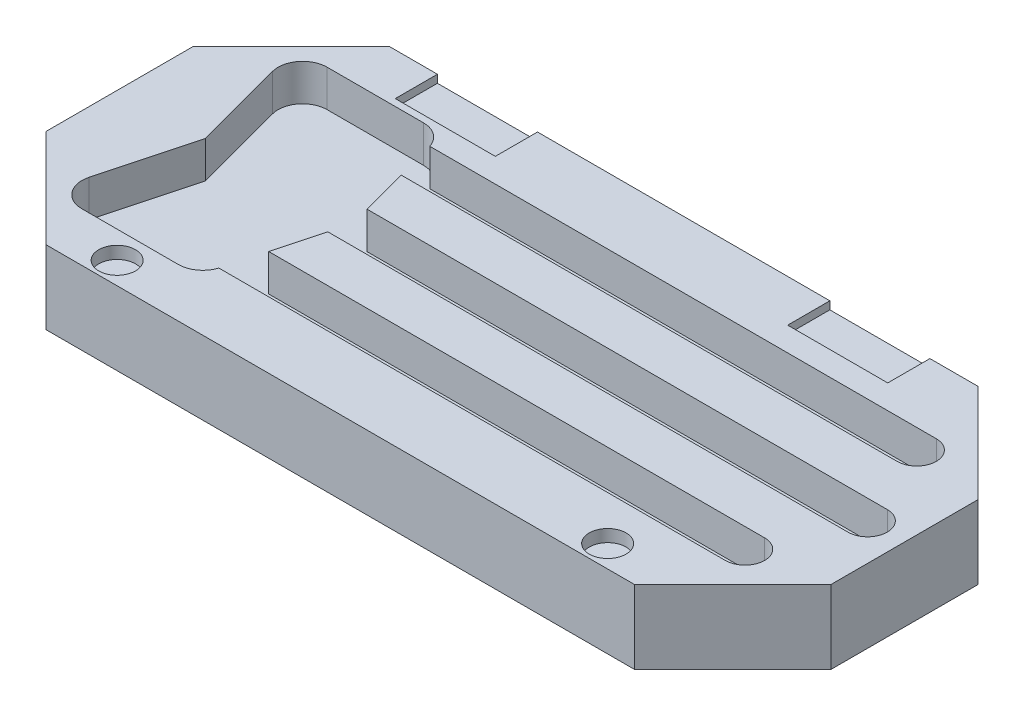
from build123d import *

# Parameters (mm, degrees)
BOSS_EXTRUDE1_DEPTH = 19.05
CUT_EXTRUDE1_DEPTH  = 9.525
CUT_EXTRUDE2_DEPTH  = 9.525
FILLET2_R           = 6.35
SKETCH5_R           = 4.7625
CUT_EXTRUDE3_DEPTH  = 3.175
SKETCH6_W           = 25.908
SKETCH6_H           = 10.922
CUT_EXTRUDE4_DEPTH  = 2.032


with BuildPart() as part:
    # Sketch1 → Boss-Extrude1 (new body)
    with BuildSketch(Plane(origin=(0, 0, 0), x_dir=(1, 0, 0), z_dir=(0, 1, 0))):
        Polygon((-101.6, -19.05), (-76.2, -44.45), (76.2, -44.45), (101.6, -19.05), (101.6, 19.05), (76.2, 44.45), (-76.2, 44.45), (-101.6, 19.05), align=None)
    extrude(amount=BOSS_EXTRUDE1_DEPTH)

    # Sketch2 → Cut-Extrude1 (cut)
    with BuildSketch(Plane(origin=(0, 19.05, 0), x_dir=(1, 0, 0), z_dir=(0, 1, 0))):
        with BuildLine():
            Line((-76.2, 27.305), (82.55, 27.305))
            ThreePointArc((82.55, 27.305), (87.63, 22.225), (82.55, 17.145))
            Line((82.55, 17.145), (-76.2, 17.145))
            ThreePointArc((-76.2, 17.145), (-81.28, 22.225), (-76.2, 27.305))
        make_face()
        with BuildLine():
            Line((92.075, -5.08), (-66.675, -5.08))
            ThreePointArc((-66.675, -5.08), (-71.755, 0), (-66.675, 5.08))
            Line((-66.675, 5.08), (92.075, 5.08))
            ThreePointArc((92.075, 5.08), (97.155, 0), (92.075, -5.08))
        make_face()
        with BuildLine():
            Line((-76.2, -17.145), (82.55, -17.145))
            ThreePointArc((82.55, -17.145), (87.63, -22.225), (82.55, -27.305))
            Line((82.55, -27.305), (-76.2, -27.305))
            ThreePointArc((-76.2, -27.305), (-81.28, -22.225), (-76.2, -17.145))
        make_face()
    extrude(amount=-CUT_EXTRUDE1_DEPTH, mode=Mode.SUBTRACT)

    # Sketch3 → Cut-Extrude2 (cut)
    with BuildSketch(Plane(origin=(0, 19.05, 0), x_dir=(1, 0, 0), z_dir=(0, 1, 0))):
        Polygon((-87.88238686, 31.75), (-79.375, 0), (-87.88238686, -31.75), (-49.78238686, -31.75), (-41.275, 0), (-49.78238686, 31.75), align=None)
    extrude(amount=-CUT_EXTRUDE2_DEPTH, mode=Mode.SUBTRACT)

    # Fillet2
    # the kernel refuses this fillet: 6.35 mm, written as the material it adds along each edge
    with BuildSketch(Plane(origin=(-49.78238686, 19.05, 31.75), x_dir=(-1, 0, 0), z_dir=(0, -1, 0))) as fillet2_piece_1:
        with BuildLine():
            CenterArc((4.866479769, 6.35), FILLET2_R, 197.457603124, 72.542396876)
            Line((-1.19103416, 4.445), (0, 0))
            Line((0, 0), (4.866479769, 0))
        make_face()
    extrude(amount=9.525)
    with BuildSketch(Plane(origin=(-49.78238686, 19.05, -31.75), x_dir=(0.2588190451025257, 0, 0.9659258262890671), z_dir=(0, -1, 0))) as fillet2_piece_2:
        with BuildLine():
            CenterArc((4.87409135, 6.344159428), FILLET2_R, 195, 72.542396876)
            Line((-1.259537647, 4.700658492), (0, 0))
            Line((0, 0), (4.601802622, 0))
        make_face()
    extrude(amount=9.525)
    with BuildSketch(Plane(origin=(-87.88238686, 19.05, 31.75), x_dir=(0.2588190451025169, 0, -0.9659258262890692), z_dir=(0, -1, 0)), Plane(origin=(-87.88238686, 19.05, -31.75), x_dir=(1, 0, 0), z_dir=(0, -1, 0))) as fillet2_piece_3:
        with BuildLine():
            CenterArc((FILLET2_R * 1.30322537284, FILLET2_R), FILLET2_R, 165, 105)
            Line((FILLET2_R * 0.337299546552, FILLET2_R * 1.2588190451), (0, 0))
            Line((0, 0), (FILLET2_R * 1.30322537284, 0))
        make_face()
    extrude(amount=9.525)

    # Sketch5 → Cut-Extrude3 (cut)
    with BuildSketch(Plane(origin=(0, 19.05, 0), x_dir=(1, 0, 0), z_dir=(0, 1, 0))):
        with Locations(Location((-63.5, -38.735, 0), (0, 0, 270))):
            Circle(SKETCH5_R)
        with Locations(Location((63.5, -38.735, 0), (0, 0, 270))):
            Circle(SKETCH5_R)
    extrude(amount=-CUT_EXTRUDE3_DEPTH, mode=Mode.SUBTRACT)

    # Sketch6 → Cut-Extrude4 (cut)
    with BuildSketch(Plane(origin=(0, 19.05, 0), x_dir=(1, 0, 0), z_dir=(0, 1, 0))):
        with Locations((-50.8, 38.989)):
            Rectangle(SKETCH6_W, SKETCH6_H)
    cut_extrude4 = extrude(amount=-CUT_EXTRUDE4_DEPTH, mode=Mode.SUBTRACT)

    # Mirror1: Cut-Extrude4 across plane
    add(cut_extrude4.mirror(Plane(origin=(0, 0, 0), x_dir=(0, 0, 1), z_dir=(1, 0, 0))), mode=Mode.SUBTRACT)


solid = part.part
